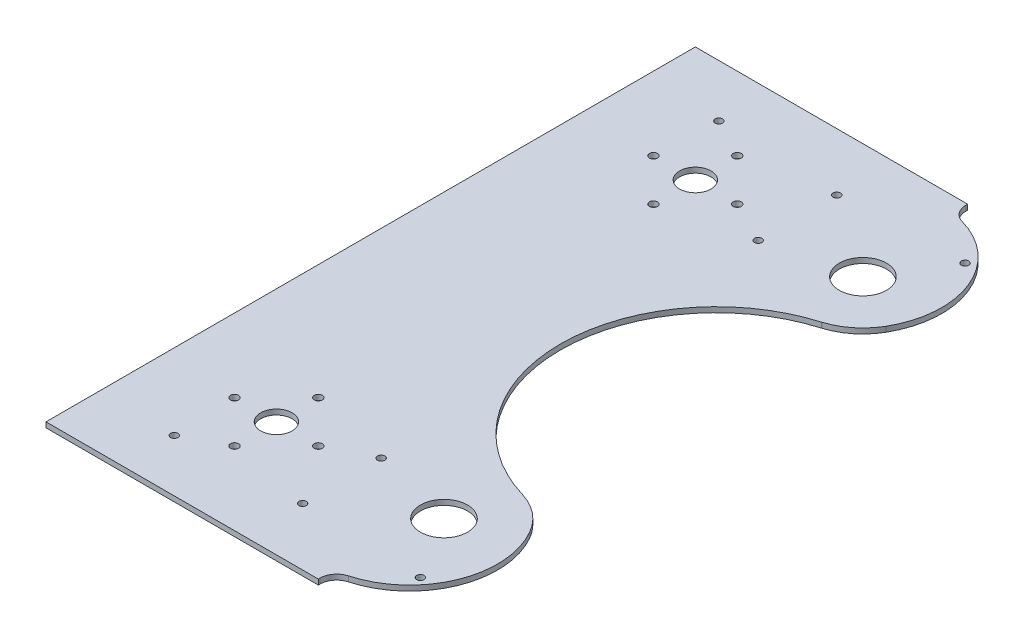
from build123d import *

# Parameters (mm, degrees)
SKETCH1_W                    = 165.1
SKETCH1_H                    = 393.7
BOSS_EXTRUDE1_DEPTH          = 3.175
CUT_EXTRUDE2_DEPTH           = 214.48186252
F_10_0_1935_DIAMETER_HOLE1_D = 4.9149
BOSS_EXTRUDE2_DEPTH          = 3.175
FILLET1_R                    = 10.16
SKETCH7_R                    = 14.2875
CUT_EXTRUDE3_DEPTH           = 236.40005037
CUT_EXTRUDE4_DEPTH           = 236.40005037
SKETCH10_R                   = 2.2479
CUT_EXTRUDE5_DEPTH           = 236.40005037


with BuildPart() as part:
    # Sketch1 → Boss-Extrude1 (new body)
    with BuildSketch(Plane(origin=(0, 0, 0), x_dir=(1, 0, 0), z_dir=(0, 1, 0))):
        Rectangle(SKETCH1_W, SKETCH1_H)
    extrude(amount=BOSS_EXTRUDE1_DEPTH)

    # Sketch3 → Cut-Extrude2 (cut, through all)
    with BuildSketch(Plane(origin=(0, 3.175, 0), x_dir=(1, 0, 0), z_dir=(0, 1, 0))):
        with BuildLine():
            ThreePointArc((-3.175, -127), (-12.7, -117.475), (-22.225, -127))
            ThreePointArc((-22.225, -127), (-12.7, -136.525), (-3.175, -127))
        make_face()
        with BuildLine():
            ThreePointArc((-3.175, 127), (-12.7, 136.525), (-22.225, 127))
            ThreePointArc((-22.225, 127), (-12.7, 117.475), (-3.175, 127))
        make_face()
    extrude(amount=-CUT_EXTRUDE2_DEPTH, mode=Mode.SUBTRACT)

    # #10 (0.1935) Diameter Hole1 (through all)
    with Locations(Plane(origin=(0, 3.175, 0), x_dir=(1, 0, 0), z_dir=(0, 1, 0))):
        with Locations((-12.7, -152.4), (-38.1, -127), (-12.7, -101.6), (12.7, -127), (-12.7, 152.4), (-38.1, 127), (-12.7, 101.6), (12.7, 127)):
            Hole(F_10_0_1935_DIAMETER_HOLE1_D / 2)

    # Sketch9 → Boss-Extrude2 (add)
    with BuildSketch(Plane(origin=(0, 0, 0), x_dir=(1, 0, 0), z_dir=(0, 1, 0))):
        with BuildLine():
            Line((82.55, 196.85), (82.55, 187.57513929))
            ThreePointArc((82.55, 187.57513929), (123.52341434, 158.287956562), (121.895567884, 107.95))
            ThreePointArc((121.895567884, 107.95), (112.736689145, 97.277580001), (100.33, 90.654916426))
            ThreePointArc((100.33, 90.654916426), (87.471865319, 81.451703359), (82.55, 66.42486071))
            Line((82.55, 66.42486071), (82.55, 57.15))
            Line((82.55, 57.15), (80.9625, 57.15))
            Line((80.9625, 57.15), (80.9625, 196.85))
            Line((80.9625, 196.85), (82.55, 196.85))
        make_face()
        with BuildLine():
            Line((80.9625, -196.85), (80.9625, -57.15))
            Line((80.9625, -57.15), (82.55, -57.15))
            Line((82.55, -57.15), (82.55, -66.42486071))
            ThreePointArc((82.55, -66.42486071), (87.471865319, -81.451703359), (100.33, -90.654916426))
            ThreePointArc((100.33, -90.654916426), (112.736689145, -97.277580001), (121.895567884, -107.95))
            ThreePointArc((121.895567884, -107.95), (123.52341434, -158.287956562), (82.55, -187.57513929))
            Line((82.55, -187.57513929), (82.55, -196.85))
            Line((82.55, -196.85), (80.9625, -196.85))
        make_face()
    extrude(amount=BOSS_EXTRUDE2_DEPTH)

    # Fillet1
    fillet1_edges = [part.edges().sort_by_distance(p)[0] for p in [
        (82.55, 1.5875, 187.57513929),
        (82.55, 1.5875, -187.57513929),
    ]]
    fillet(fillet1_edges, radius=FILLET1_R)

    # Sketch7 → Cut-Extrude3 (cut, through all)
    with BuildSketch(Plane(origin=(0, 3.175, 0), x_dir=(1, 0, 0), z_dir=(0, 1, 0))):
        with Locations((88.9, -127)):
            Circle(SKETCH7_R)
        with Locations((88.9, 127)):
            Circle(SKETCH7_R)
    extrude(amount=-CUT_EXTRUDE3_DEPTH, mode=Mode.SUBTRACT)

    # Sketch8 → Cut-Extrude4 (cut, through all)
    with BuildSketch(Plane(origin=(0, 3.175, 0), x_dir=(1, 0, 0), z_dir=(0, 1, 0))):
        with BuildLine():
            Line((127, -94.491892663), (127, 94.491892663))
            ThreePointArc((127, 94.491892663), (32.508107337, 0), (127, -94.491892663))
        make_face()
    extrude(amount=-CUT_EXTRUDE4_DEPTH, mode=Mode.SUBTRACT)

    # Sketch10 → Cut-Extrude5 (cut, through all)
    with BuildSketch(Plane(origin=(0, 3.175, 0), x_dir=(1, 0, 0), z_dir=(0, 1, 0))):
        with Locations((38.1, -114.3)):
            Circle(SKETCH10_R)
        with Locations((-36.5125, -165.1)):
            Circle(SKETCH10_R)
        with Locations((38.1, -161.925)):
            Circle(SKETCH10_R)
        with Locations((112.7125, -165.1)):
            Circle(SKETCH10_R)
        with Locations((112.7125, 165.1)):
            Circle(SKETCH10_R)
        with Locations((38.1, 161.925)):
            Circle(SKETCH10_R)
        with Locations((38.1, 114.3)):
            Circle(SKETCH10_R)
        with Locations((-36.5125, 165.1)):
            Circle(SKETCH10_R)
    extrude(amount=-CUT_EXTRUDE5_DEPTH, mode=Mode.SUBTRACT)


solid = part.part
